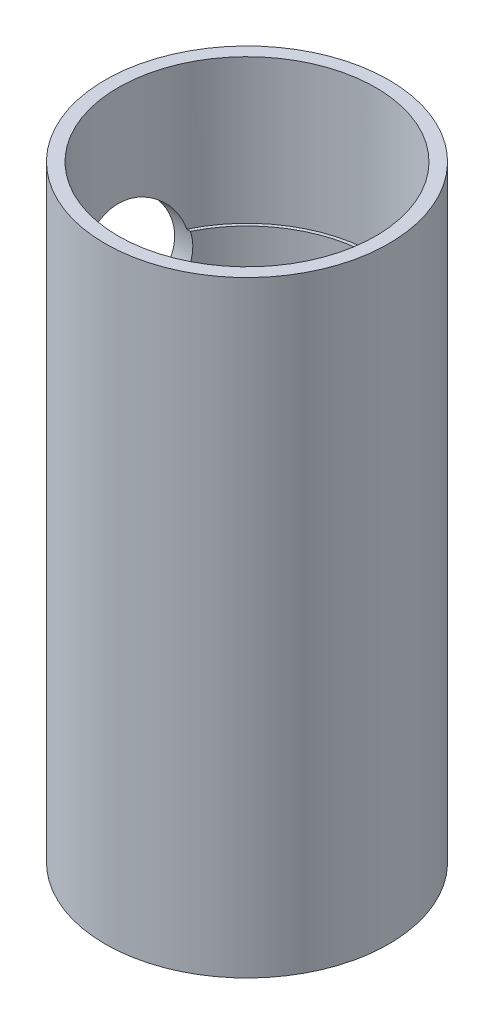
from build123d import *

# Parameters (mm, degrees)
SKETCH1_R           = 43.25
SKETCH1_R_2         = 38.25
BOSS_EXTRUDE1_DEPTH = 92.5
BOSS_EXTRUDE2_START = -6.35
SKETCH2_R           = 38.25
SKETCH2_R_2         = 36.25
BOSS_EXTRUDE2_DEPTH = 100
CUT_EXTRUDE3_START  = -44
SKETCH6_R           = 39.25
SKETCH6_R_2         = 38.25
CUT_EXTRUDE3_DEPTH  = 44
SKETCH7_R           = 17.5
CUT_EXTRUDE4_DEPTH  = 111.893530019


with BuildPart() as part:
    # Sketch1 → Boss-Extrude1 (new, symmetric)
    with BuildSketch(Plane(origin=(0, 0, 0), x_dir=(1, 0, 0), z_dir=(0, 1, 0))):
        Circle(SKETCH1_R)
        Circle(SKETCH1_R_2, mode=Mode.SUBTRACT)
    extrude(amount=BOSS_EXTRUDE1_DEPTH, both=True)

    # Sketch2 → Boss-Extrude2 (add)
    with BuildSketch(Plane.XZ.offset(92.5).offset(BOSS_EXTRUDE2_START)):
        Circle(SKETCH2_R)
        Circle(SKETCH2_R_2, mode=Mode.SUBTRACT)
    extrude(amount=-BOSS_EXTRUDE2_DEPTH)

    # Sketch6 → Cut-Extrude3 (cut)
    with BuildSketch(Plane(origin=(0, 92.5, 0), x_dir=(1, 0, 0), z_dir=(0, 1, 0)).offset(CUT_EXTRUDE3_START)):
        Circle(SKETCH6_R)
        Circle(SKETCH6_R_2, mode=Mode.SUBTRACT)
    extrude(amount=CUT_EXTRUDE3_DEPTH, mode=Mode.SUBTRACT)

    # Sketch7 → Cut-Extrude4 (cut, through all)
    with BuildSketch(Plane(origin=(0, 0, 0), x_dir=(0, 0, -1), z_dir=(1, 0, 0))):
        with Locations((0, 44.35)):
            Circle(SKETCH7_R)
    extrude(amount=-CUT_EXTRUDE4_DEPTH, mode=Mode.SUBTRACT)


solid = part.part
